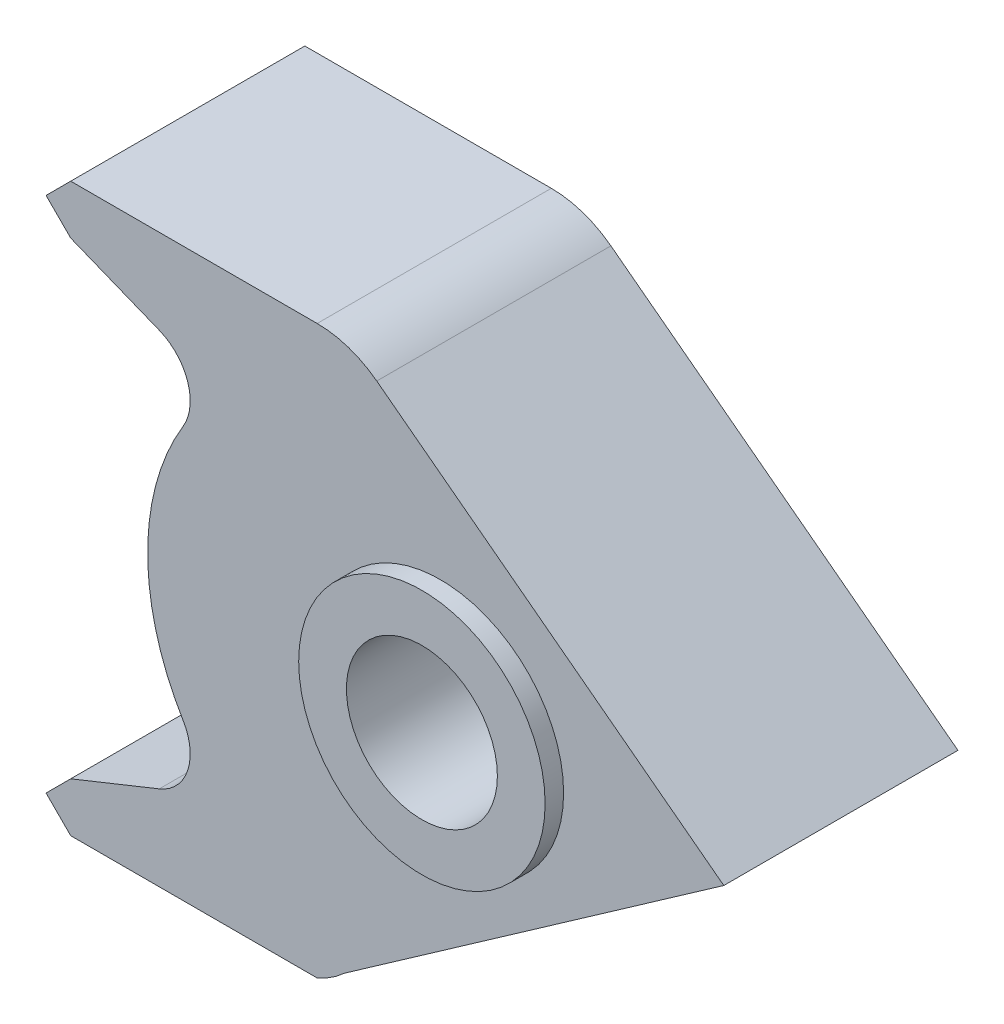
from build123d import *

# Parameters (mm, degrees)
ESBO_O1_R                = 6.125
RESSALTO_EXTRUS_O1_DEPTH = 22
ESBO_O2_OUTSIDE_W        = 72
ESBO_O2_OUTSIDE_H        = 63
ESBO_O2_OUTSIDE_R        = 10
CORTE_EXTRUS_O1_DEPTH    = 1.5
ESBO_O3_OUTSIDE_W        = 72
ESBO_O3_OUTSIDE_H        = 63
ESBO_O3_OUTSIDE_R        = 10
CORTE_EXTRUS_O2_DEPTH    = 1.5


with BuildPart() as part:
    # Esboço1 → Ressalto-extrusão1 (new body)
    with BuildSketch(Plane.XY):
        with BuildLine():
            Line((-30.781182975, -21.553216354), (0, 0))
            Line((0, 0), (-28.163895976, 21.372762185))
            ThreePointArc((-28.163895976, 21.372762185), (-30.448735361, 22.582285193), (-33, 23))
            Line((-33, 23), (-53, 23))
            Line((-53, 23), (-55, 21))
            Line((-55, 21), (-53, 19))
            Line((-53, 19), (-45.812043902, 16.114839283))
            ThreePointArc((-45.812043902, 16.114839283), (-43.50890364, 13.67237999), (-43.877574187, 10.335593438))
            ThreePointArc((-43.877574187, 10.335593438), (-46.755205534, 0), (-43.877574187, -10.335593438))
            ThreePointArc((-43.877574187, -10.335593438), (-43.50890364, -13.67237999), (-45.812043902, -16.114839283))
            Line((-45.812043902, -16.114839283), (-53, -19))
            Line((-53, -19), (-55, -21))
            Line((-55, -21), (-53, -23))
            Line((-53, -23), (-33, -23))
            ThreePointArc((-33, -23), (-31.830295908, -22.369078713), (-30.781182975, -21.553216354))
        make_face()
        with Locations((-23, 0)):
            Circle(ESBO_O1_R, mode=Mode.SUBTRACT)
    extrude(amount=RESSALTO_EXTRUS_O1_DEPTH)

    # Esboço2 outside → Corte-extrusão1 (cut)
    with BuildSketch(Plane.XY.offset(22)):
        with Locations((-27.5, 0)):
            Rectangle(ESBO_O2_OUTSIDE_W, ESBO_O2_OUTSIDE_H)
        with Locations((-23, 0)):
            Circle(ESBO_O2_OUTSIDE_R, mode=Mode.SUBTRACT)
    extrude(amount=-CORTE_EXTRUS_O1_DEPTH, mode=Mode.SUBTRACT)

    # Esboço3 outside → Corte-extrusão2 (cut)
    with BuildSketch(Plane(origin=(0, 0, 0), x_dir=(-1, 0, 0), z_dir=(0, 0, -1))):
        with Locations((27.5, 0)):
            Rectangle(ESBO_O3_OUTSIDE_W, ESBO_O3_OUTSIDE_H)
        with Locations((23, 0)):
            Circle(ESBO_O3_OUTSIDE_R, mode=Mode.SUBTRACT)
    extrude(amount=-CORTE_EXTRUS_O2_DEPTH, mode=Mode.SUBTRACT)


solid = part.part
